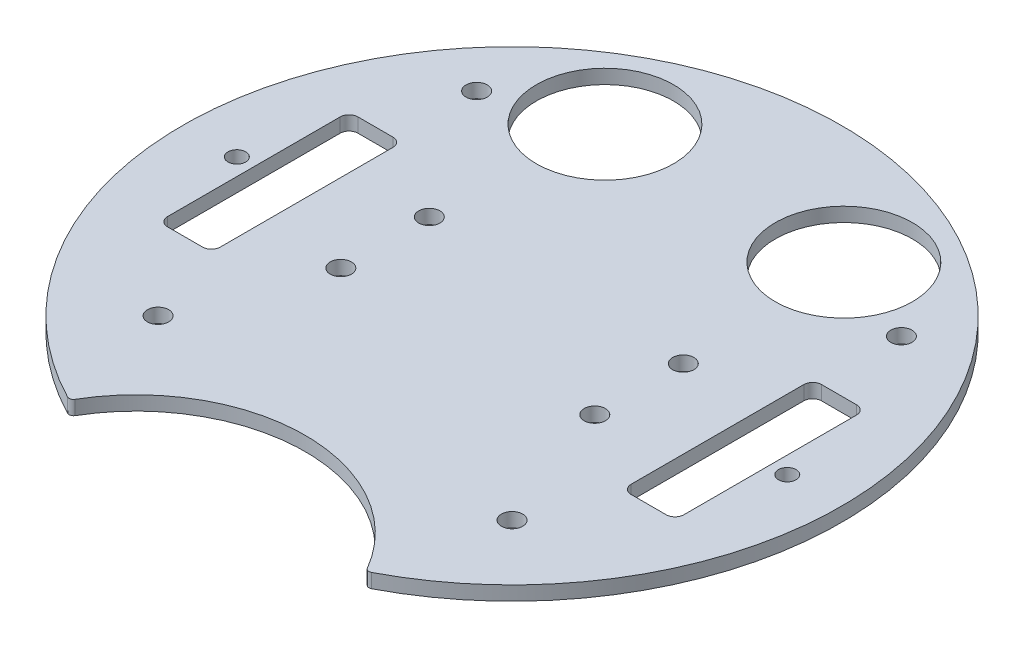
from build123d import *

# Parameters (mm, degrees)
BOSS_EXTRUDE1_DEPTH = 3.2
SKETCH2_W           = 10.76
SKETCH2_H           = 41.868700306
CUT_EXTRUDE1_DEPTH  = 106.40749499
SKETCH3_R           = 2
SKETCH3_R_2         = 2.4
CUT_EXTRUDE2_DEPTH  = 106.40749499
SKETCH4_R           = 15
CUT_EXTRUDE3_DEPTH  = 106.40749499
CUT_EXTRUDE4_DEPTH  = 106.40749499
SKETCH6_R           = 2.4
CUT_EXTRUDE5_DEPTH  = 106.40749499
SKETCH8_R           = 15.5
CUT_EXTRUDE6_DEPTH  = 106.40749499


with BuildPart() as part:
    # Sketch1 → Boss-Extrude1 (new body)
    with BuildSketch(Plane(origin=(0, 0, 0), x_dir=(1, 0, 0), z_dir=(0, 1, 0))):
        with BuildLine():
            ThreePointArc((34.36030176, -66.103098739), (0, 74.5), (-34.36030176, -66.103098739))
            ThreePointArc((-34.36030176, -66.103098739), (-33.621222066, -66.176428208), (-33.035418582, -65.71986465))
            ThreePointArc((-33.035418582, -65.71986465), (0, -46.75), (33.035418582, -65.71986465))
            ThreePointArc((33.035418582, -65.71986465), (33.621222066, -66.176428208), (34.36030176, -66.103098739))
        make_face()
    extrude(amount=BOSS_EXTRUDE1_DEPTH)

    # Sketch2 → Cut-Extrude1 (cut, through all)
    with BuildSketch(Plane(origin=(0, 3.2, 0), x_dir=(1, 0, 0), z_dir=(0, 1, 0))):
        with Locations((-52.39, 0)):
            Rectangle(SKETCH2_W, SKETCH2_H)
        with Locations((52.39, 0)):
            Rectangle(SKETCH2_W, SKETCH2_H)
    extrude(amount=-CUT_EXTRUDE1_DEPTH, mode=Mode.SUBTRACT)

    # Sketch3 → Cut-Extrude2 (cut, through all)
    with BuildSketch(Plane.XZ):
        with Locations((-62.2, 0)):
            Circle(SKETCH3_R)
        with Locations((-28.700738686, 10)):
            Circle(SKETCH3_R_2)
        with Locations((-28.700738686, -10)):
            Circle(SKETCH3_R_2)
        with Locations((28.700738686, -10)):
            Circle(SKETCH3_R_2)
        with Locations((28.700738686, 10)):
            Circle(SKETCH3_R_2)
        with Locations((62.2, 0)):
            Circle(SKETCH3_R)
    extrude(amount=-CUT_EXTRUDE2_DEPTH, mode=Mode.SUBTRACT)

    # Sketch4 → Cut-Extrude3 (cut, through all)
    with BuildSketch(Plane(origin=(0, 3.2, 0), x_dir=(1, 0, 0), z_dir=(0, 1, 0))):
        with Locations((-27, 48)):
            Circle(SKETCH4_R)
        with Locations((27, 48)):
            Circle(SKETCH4_R)
    extrude(amount=-CUT_EXTRUDE3_DEPTH, mode=Mode.SUBTRACT)

    # Sketch5 → Cut-Extrude4 (cut, through all)
    with BuildSketch(Plane(origin=(0, 3.2, 0), x_dir=(1, 0, 0), z_dir=(0, 1, 0))):
        with BuildLine():
            Line((-56.355786438, 21.520136591), (-48.424213562, 21.520136591))
            ThreePointArc((-48.424213562, 21.520136591), (-47.01, 20.934350153), (-46.424213562, 19.520136591))
            Line((-46.424213562, 19.520136591), (-46.424213562, -19.520136591))
            ThreePointArc((-46.424213562, -19.520136591), (-47.01, -20.934350153), (-48.424213562, -21.520136591))
            Line((-48.424213562, -21.520136591), (-56.355786438, -21.520136591))
            ThreePointArc((-56.355786438, -21.520136591), (-57.77, -20.934350153), (-58.355786438, -19.520136591))
            Line((-58.355786438, -19.520136591), (-58.355786438, 19.520136591))
            ThreePointArc((-58.355786438, 19.520136591), (-57.77, 20.934350153), (-56.355786438, 21.520136591))
        make_face()
        with BuildLine():
            Line((46.424213562, 19.520136591), (46.424213562, -19.520136591))
            ThreePointArc((46.424213562, -19.520136591), (47.01, -20.934350153), (48.424213562, -21.520136591))
            Line((48.424213562, -21.520136591), (56.355786438, -21.520136591))
            ThreePointArc((56.355786438, -21.520136591), (57.77, -20.934350153), (58.355786438, -19.520136591))
            Line((58.355786438, -19.520136591), (58.355786438, 19.520136591))
            ThreePointArc((58.355786438, 19.520136591), (57.77, 20.934350153), (56.355786438, 21.520136591))
            Line((56.355786438, 21.520136591), (48.424213562, 21.520136591))
            ThreePointArc((48.424213562, 21.520136591), (47.01, 20.934350153), (46.424213562, 19.520136591))
        make_face()
    extrude(amount=-CUT_EXTRUDE4_DEPTH, mode=Mode.SUBTRACT)

    # Sketch6 → Cut-Extrude5 (cut, through all)
    with BuildSketch(Plane(origin=(0, 3.2, 0), x_dir=(1, 0, 0), z_dir=(0, 1, 0))):
        with Locations((48, 40)):
            Circle(SKETCH6_R)
        with Locations((-40, -40)):
            Circle(SKETCH6_R)
        with Locations((40, -40)):
            Circle(SKETCH6_R)
        with Locations((-48, 40)):
            Circle(SKETCH6_R)
    extrude(amount=-CUT_EXTRUDE5_DEPTH, mode=Mode.SUBTRACT)

    # Sketch8 → Cut-Extrude6 (cut, through all)
    with BuildSketch(Plane(origin=(0, 3.2, 0), x_dir=(1, 0, 0), z_dir=(0, 1, 0))):
        with Locations((-27, 48)):
            Circle(SKETCH8_R)
        with Locations((27, 48)):
            Circle(SKETCH8_R)
    extrude(amount=-CUT_EXTRUDE6_DEPTH, mode=Mode.SUBTRACT)


solid = part.part
